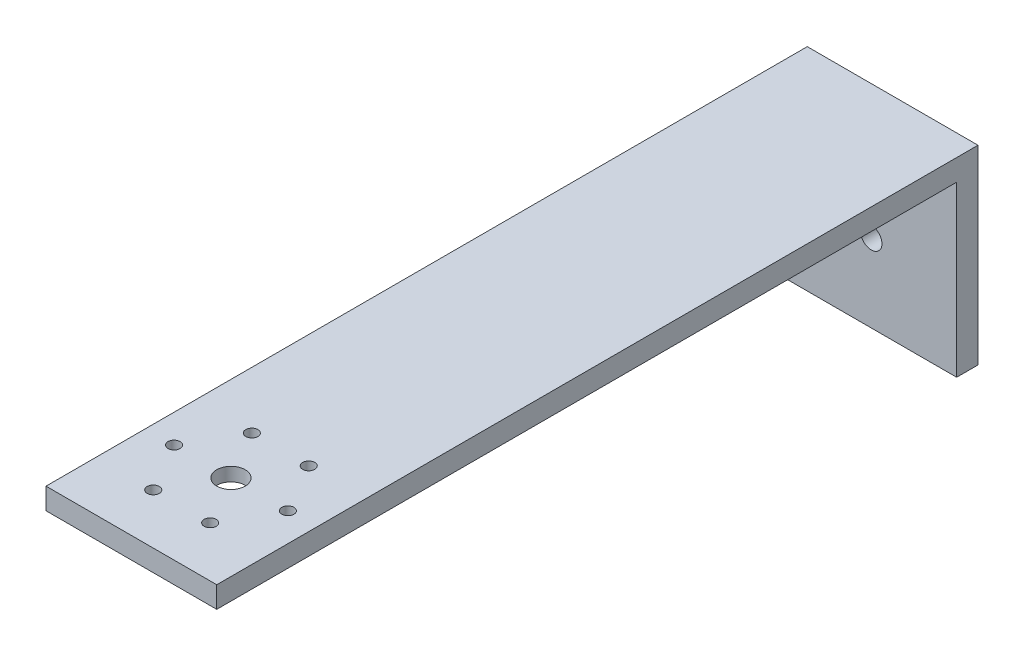
from build123d import *

# Parameters (mm, degrees)
SK_FOREARM_PLATE_W       = 48
SK_FOREARM_PLATE_H       = 208
SK_FOREARM_PLATE_R       = 1.7
SK_FOREARM_PLATE_R_2     = 4
FOREARM_PLATE_DEPTH      = 6
SK_ELBOW_PILOT_RECESS_R  = 12.15
ELBOW_PILOT_RECESS_DEPTH = 2.2
SK_HAND_PLATE_W          = 48
SK_HAND_PLATE_H          = 53.5
SK_HAND_PLATE_R          = 3
HAND_PLATE_DEPTH         = 6


with BuildPart() as part:
    # SK_Forearm_Plate → Forearm_Plate (new body)
    with BuildSketch(Plane(origin=(0, 25.5, 0), x_dir=(1, 0, 0), z_dir=(0, 1, 0))):
        with Locations((0, 76)):
            Rectangle(SK_FOREARM_PLATE_W, SK_FOREARM_PLATE_H)
        with Locations((16, 0)):
            Circle(SK_FOREARM_PLATE_R, mode=Mode.SUBTRACT)
        with Locations((8, 13.856406461)):
            Circle(SK_FOREARM_PLATE_R, mode=Mode.SUBTRACT)
        with Locations((-8, 13.856406461)):
            Circle(SK_FOREARM_PLATE_R, mode=Mode.SUBTRACT)
        with Locations((-16, 0)):
            Circle(SK_FOREARM_PLATE_R, mode=Mode.SUBTRACT)
        with Locations((-8, -13.856406461)):
            Circle(SK_FOREARM_PLATE_R, mode=Mode.SUBTRACT)
        with Locations((8, -13.856406461)):
            Circle(SK_FOREARM_PLATE_R, mode=Mode.SUBTRACT)
        Circle(SK_FOREARM_PLATE_R_2, mode=Mode.SUBTRACT)
    extrude(amount=FOREARM_PLATE_DEPTH)

    # SK_Elbow_Pilot_Recess → Elbow_Pilot_Recess (cut)
    with BuildSketch(Plane(origin=(0, 25.5, 0), x_dir=(1, 0, 0), z_dir=(0, 1, 0))):
        Circle(SK_ELBOW_PILOT_RECESS_R)
    extrude(amount=ELBOW_PILOT_RECESS_DEPTH, mode=Mode.SUBTRACT)

    # SK_Hand_Plate → Hand_Plate (add)
    with BuildSketch(Plane.XY.offset(-186)):
        with Locations((0, 4.75)):
            Rectangle(SK_HAND_PLATE_W, SK_HAND_PLATE_H)
        Circle(SK_HAND_PLATE_R, mode=Mode.SUBTRACT)
    extrude(amount=HAND_PLATE_DEPTH)


solid = part.part
